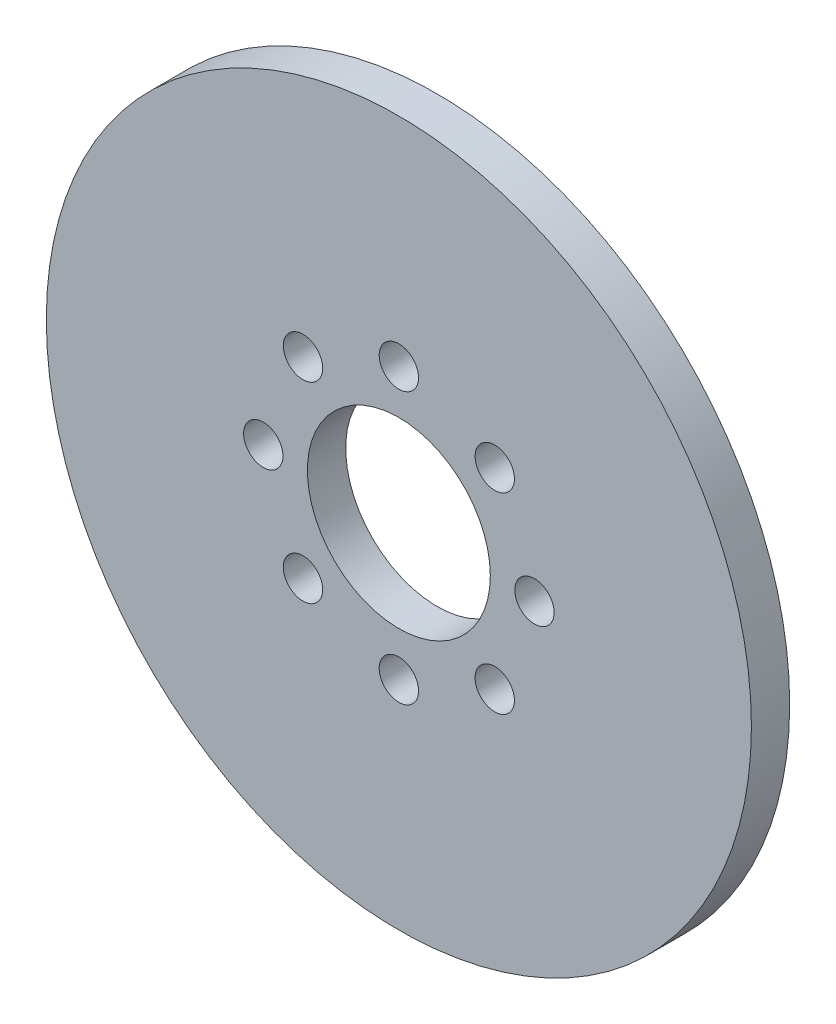
from build123d import *

# Parameters (mm, degrees)
SKETCH1_R           = 58.5
SKETCH1_R_2         = 3.2639
SKETCH1_R_3         = 15.175
BOSS_EXTRUDE1_DEPTH = 6.35


with BuildPart() as part:
    # Sketch1 → Boss-Extrude1 (new body)
    with BuildSketch(Plane.XY):
        Circle(SKETCH1_R)
        with Locations((-15.909902577, -15.909902577)):
            Circle(SKETCH1_R_2, mode=Mode.SUBTRACT)
        with Locations((0, -22.5)):
            Circle(SKETCH1_R_2, mode=Mode.SUBTRACT)
        with Locations((15.909902577, -15.909902577)):
            Circle(SKETCH1_R_2, mode=Mode.SUBTRACT)
        with Locations((-22.5, 0)):
            Circle(SKETCH1_R_2, mode=Mode.SUBTRACT)
        with Locations((-15.909902577, 15.909902577)):
            Circle(SKETCH1_R_2, mode=Mode.SUBTRACT)
        Circle(SKETCH1_R_3, mode=Mode.SUBTRACT)
        with Locations((22.5, 0)):
            Circle(SKETCH1_R_2, mode=Mode.SUBTRACT)
        with Locations((0, 22.5)):
            Circle(SKETCH1_R_2, mode=Mode.SUBTRACT)
        with Locations((15.909902577, 15.909902577)):
            Circle(SKETCH1_R_2, mode=Mode.SUBTRACT)
    extrude(amount=BOSS_EXTRUDE1_DEPTH)


solid = part.part
